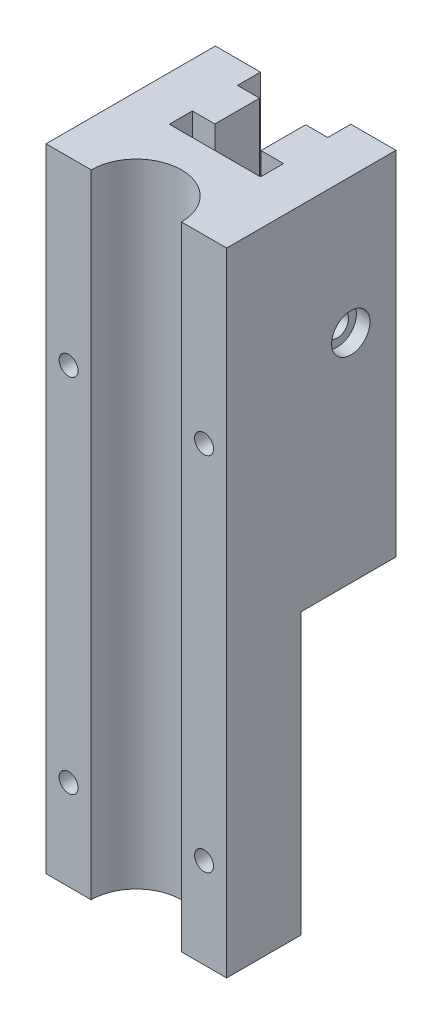
from build123d import *

# Parameters (mm, degrees)
BOSS_EXTRUDE1_DEPTH = 140
SKETCH5_W           = 40
SKETCH5_H           = 21
CUT_EXTRUDE5_DEPTH  = 62
SKETCH3_3_R         = 2.5
CUT_EXTRUDE3_DEPTH  = 151.353749538
SKETCH3_R           = 4.25
SKETCH3_R_2         = 2.5
CUT_EXTRUDE4_DEPTH  = 3
SKETCH7_R           = 2.1
CUT_EXTRUDE7_DEPTH  = 10
CUT_EXTRUDE8_START  = -3
SKETCH10_R          = 2.5
CUT_EXTRUDE8_DEPTH  = 3


with BuildPart() as part:
    # Sketch1 → Boss-Extrude1 (new body)
    with BuildSketch(Plane(origin=(0, 0, 0), x_dir=(1, 0, 0), z_dir=(0, 1, 0))):
        with BuildLine():
            Line((-10, -5.1), (-10, 0))
            Line((-10, 0), (-20, 0))
            Line((-20, 0), (-20, -37.5))
            Line((-20, -37.5), (-10, -37.5))
            ThreePointArc((-10, -37.5), (0, -27.5), (10, -37.5))
            Line((10, -37.5), (20, -37.5))
            Line((20, -37.5), (20, 0))
            Line((20, 0), (10, 0))
            Line((10, 0), (10, -5.1))
            Line((10, -5.1), (5.1, -5.1))
            Line((5.1, -5.1), (5.1, -15))
            Line((5.1, -15), (10.1, -15))
            Line((10.1, -15), (10.1, -20.1))
            Line((10.1, -20.1), (-10.1, -20.1))
            Line((-10.1, -20.1), (-10.1, -15))
            Line((-10.1, -15), (-5.1, -15))
            Line((-5.1, -15), (-5.1, -5.1))
            Line((-5.1, -5.1), (-10, -5.1))
        make_face()
    extrude(amount=-BOSS_EXTRUDE1_DEPTH)

    # Sketch5 → Cut-Extrude5 (cut)
    with BuildSketch(Plane.XZ.offset(140)):
        with Locations((0, 10.5)):
            Rectangle(SKETCH5_W, SKETCH5_H)
    extrude(amount=-CUT_EXTRUDE5_DEPTH, mode=Mode.SUBTRACT)

    # Sketch3<3> → Cut-Extrude3 (cut, through all)
    with BuildSketch(Plane(origin=(20, 0, 0), x_dir=(0, 0, -1), z_dir=(1, 0, 0))):
        with Locations((-10, -30)):
            Circle(SKETCH3_3_R)
    extrude(amount=-CUT_EXTRUDE3_DEPTH, mode=Mode.SUBTRACT)

    # Sketch3 → Cut-Extrude4 (cut)
    with BuildSketch(Plane(origin=(20, 0, 0), x_dir=(0, 0, -1), z_dir=(1, 0, 0))):
        with Locations((-10, -30)):
            Circle(SKETCH3_R)
        with Locations((-10, -30)):
            Circle(SKETCH3_R_2, mode=Mode.SUBTRACT)
    extrude(amount=-CUT_EXTRUDE4_DEPTH, mode=Mode.SUBTRACT)

    # Sketch7 → Cut-Extrude7 (cut)
    with BuildSketch(Plane.XY.offset(37.5)):
        with Locations((-15, -120)):
            Circle(SKETCH7_R)
        with Locations((15, -120)):
            Circle(SKETCH7_R)
        with Locations((-15, -40)):
            Circle(SKETCH7_R)
        with Locations((15, -40)):
            Circle(SKETCH7_R)
    extrude(amount=-CUT_EXTRUDE7_DEPTH, mode=Mode.SUBTRACT)

    # Sketch10 → Cut-Extrude8 (cut)
    with BuildSketch(Plane.ZY.offset(20).offset(CUT_EXTRUDE8_START)):
        Polygon((13.49946403, -29.9387505), (11.696688392, -26.9387505), (8.197224362, -27), (6.50053597, -30.0612495), (8.303311608, -33.0612495), (11.802775638, -33), align=None)
        with Locations((10, -30)):
            Circle(SKETCH10_R, mode=Mode.SUBTRACT)
    extrude(amount=CUT_EXTRUDE8_DEPTH, mode=Mode.SUBTRACT)


solid = part.part
